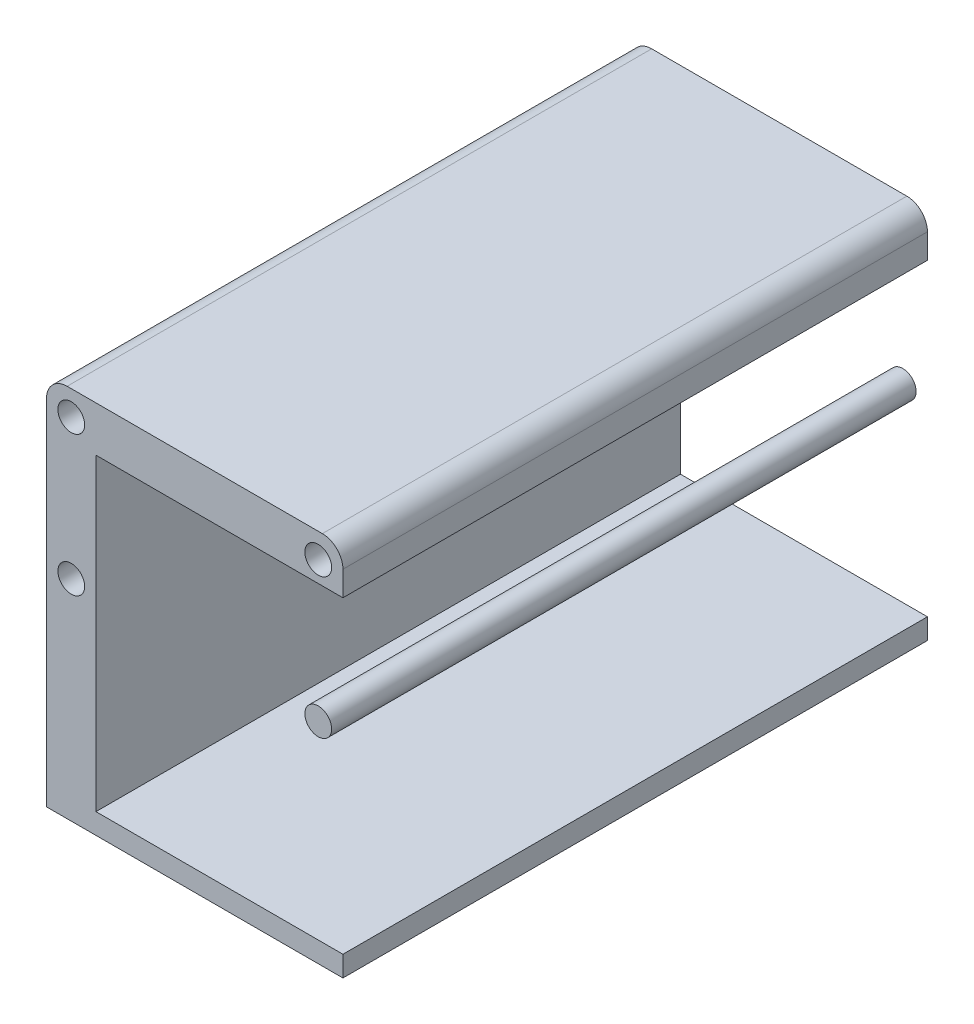
from build123d import *

# Parameters (mm, degrees)
SKETCH3_R             = 3.25
BOSS_EXTRUDE2_DEPTH   = 142
BOSS_EXTRUDE2_2_DEPTH = 142


with BuildPart() as part:
    # Sketch3 → Boss-Extrude2 (new body)
    with BuildSketch(Plane.XY.offset(5)):
        with Locations((30, 51)):
            Circle(SKETCH3_R)
    extrude(amount=BOSS_EXTRUDE2_DEPTH)


with BuildPart() as body_2:
    # Sketch3 → Boss-Extrude2 2 (new body)
    with BuildSketch(Plane.XY.offset(5)):
        with BuildLine():
            Line((31, 91), (-31, 91))
            ThreePointArc((-31, 91), (-34.535533906, 89.535533906), (-36, 86))
            Line((-36, 86), (-36, 0))
            Line((-36, 0), (36, 0))
            Line((36, 0), (36, 5))
            Line((36, 5), (-24, 5))
            Line((-24, 5), (-24, 80))
            Line((-24, 80), (36, 80))
            Line((36, 80), (36, 86))
            ThreePointArc((36, 86), (34.535533906, 89.535533906), (31, 91))
        make_face()
        with Locations((30, 85)):
            Circle(SKETCH3_R, mode=Mode.SUBTRACT)
        with Locations((-30, 51)):
            Circle(SKETCH3_R, mode=Mode.SUBTRACT)
        with Locations((-30, 85)):
            Circle(SKETCH3_R, mode=Mode.SUBTRACT)
    extrude(amount=BOSS_EXTRUDE2_2_DEPTH)


solid = Compound([part.part, body_2.part])
